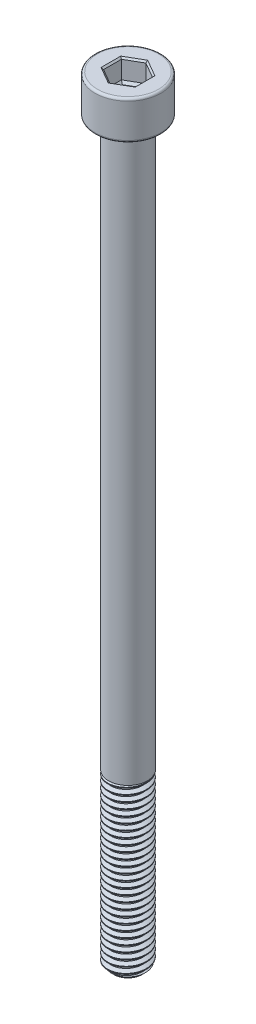
from build123d import *

# Parameters (mm, degrees)
SKETCH1_R           = 2.5
BOSS_EXTRUDE1_DEPTH = 22
THREAD1_PITCH       = 0.8
SKETCH2_R           = 2.5
BOSS_EXTRUDE2_DEPTH = 73
SKETCH3_R           = 4.25
BOSS_EXTRUDE3_DEPTH = 5
FILLET1_R           = 0.3
CUT_EXTRUDE1_DEPTH  = 2.5
CHAMFER1_SIZE       = 0.2
CUT_EXTRUDE2_DEPTH  = 0.3
CUT_EXTRUDE2_DRAFT  = -45


with BuildPart() as part:
    # Sketch1 → Boss-Extrude1 (new body)
    with BuildSketch(Plane(origin=(0, 0, 0), x_dir=(1, 0, 0), z_dir=(0, 1, 0))):
        with Locations(Location((0, 0, 0), (0, 0, 270))):
            Circle(SKETCH1_R)
    extrude(amount=BOSS_EXTRUDE1_DEPTH)

    # Thread1: the profile of Thread Profile1 profile screwed along a right-hand helix of 28.75 turns, 8 arcs to a turn; built about Z, then put on its axis
    thread1_z = Axis((0, 0, 0), (0, 0, 1))
    thread1_corners = [(2.5003, 0, -0.000173205), (2.5003, 0, 0.700173203), (2.0669873, 0, 0.449999999), (2.0669873, 0, 0.249999999)]
    with BuildLine(mode=Mode.PRIVATE) as thread1_profile:
        Line(thread1_corners[0], thread1_corners[1])
        Line(thread1_corners[1], thread1_corners[2])
        Line(thread1_corners[2], thread1_corners[3])
        Line(thread1_corners[3], thread1_corners[0])
    thread1_cap = Face(thread1_profile.wire())
    thread1_turn_angles = [0, 22.5, 45, 67.5, 90, 112.5, 135, 157.5, 180, 202.5, 225, 247.5, 270, 292.5, 315, 337.5, 360]
    thread1_turn_weights = [1, 0.9238795325112867, 1, 0.9238795325112867, 1, 0.9238795325112867, 1, 0.9238795325112867, 1, 0.9238795325112867, 1, 0.9238795325112867, 1, 0.9238795325112867, 1, 0.9238795325112867, 1]
    thread1_turn_rails = [Edge.make_bspline([Vector(p[0], p[1], 0).rotate(thread1_z, thread1_turn_angles[k]) / thread1_turn_weights[k] + Vector(0, 0, p[2] + THREAD1_PITCH * thread1_turn_angles[k] / 360) for k in range(17)], [0, 0, 0, 1, 1, 2, 2, 3, 3, 4, 4, 5, 5, 6, 6, 7, 7, 8, 8, 8], 2, thread1_turn_weights) for p in thread1_corners]
    thread1_turn_sides = [Face.make_surface_from_curves(thread1_turn_rails[p[0]], thread1_turn_rails[p[1]]) for p in [(0, 1), (1, 2), (2, 3), (3, 0)]]
    thread1_last_angles = [10080, 10102.5, 10125, 10147.5, 10170, 10192.5, 10215, 10237.5, 10260, 10282.5, 10305, 10327.5, 10350]
    thread1_last_weights = [1, 0.9238795325112867, 1, 0.9238795325112867, 1, 0.9238795325112867, 1, 0.9238795325112867, 1, 0.9238795325112867, 1, 0.9238795325112867, 1]
    thread1_last_rails = [Edge.make_bspline([Vector(p[0], p[1], 0).rotate(thread1_z, thread1_last_angles[k]) / thread1_last_weights[k] + Vector(0, 0, p[2] + THREAD1_PITCH * thread1_last_angles[k] / 360) for k in range(13)], [0, 0, 0, 1, 1, 2, 2, 3, 3, 4, 4, 5, 5, 6, 6, 6], 2, thread1_last_weights) for p in thread1_corners]
    thread1_last_sides = [Face.make_surface_from_curves(thread1_last_rails[p[0]], thread1_last_rails[p[1]]) for p in [(0, 1), (1, 2), (2, 3), (3, 0)]]
    thread1 = Plane(origin=(0, 23, 0), x_dir=(-1, 0, 0), z_dir=(0, -1, 0)) * Solid(Shell([*[p.moved(Location((0, 0, THREAD1_PITCH * i))) for i in range(28) for p in thread1_turn_sides], *thread1_last_sides, thread1_cap, thread1_cap.rotate(thread1_z, 10350).moved(Location((0, 0, THREAD1_PITCH * 10350 / 360)))]))
    add(thread1, mode=Mode.SUBTRACT)

    # Sketch2 → Boss-Extrude2 (add)
    with BuildSketch(Plane(origin=(0, 22, 0), x_dir=(1, 0, 0), z_dir=(0, 1, 0))):
        with Locations(Location((0, 0, 0), (0, 0, 90))):
            Circle(SKETCH2_R)
    extrude(amount=BOSS_EXTRUDE2_DEPTH)

    # Sketch3 → Boss-Extrude3 (add)
    with BuildSketch(Plane(origin=(0, 95, 0), x_dir=(1, 0, 0), z_dir=(0, 1, 0))):
        with Locations(Location((0, 0, 0), (0, 0, 270))):
            Circle(SKETCH3_R)
    extrude(amount=BOSS_EXTRUDE3_DEPTH)

    # Fillet1
    fillet1_edges = [part.edges().sort_by_distance(p)[0] for p in [
        (0, 95, -4.25),
        (0, 100, -4.25),
    ]]
    fillet(fillet1_edges, radius=FILLET1_R)

    # Sketch4 → Cut-Revolve1 (revolve, cut)
    with BuildSketch(Plane.XY, mode=Mode.PRIVATE) as cut_revolve1_sk:
        Polygon((2.51, 0), (2.51, 0.7), (1.81, 0), align=None)
    revolve(cut_revolve1_sk.sketch.rotate(Axis((0, 0, 0), (0, 1, 0)), 90), axis=Axis((0, 0, 0), (0, 1, 0)), mode=Mode.SUBTRACT)

    # Sketch5 → Cut-Extrude1 (cut)
    with BuildSketch(Plane(origin=(0, 100, 0), x_dir=(1, 0, 0), z_dir=(0, 1, 0))):
        Polygon((0, 2.309401077), (-2, 1.154700538), (-2, -1.154700538), (0, -2.309401077), (2, -1.154700538), (2, 1.154700538), align=None)
    extrude(amount=-CUT_EXTRUDE1_DEPTH, mode=Mode.SUBTRACT)

    # Chamfer1
    chamfer1_edges = [part.edges().sort_by_distance(p)[0] for p in [
        (1, 100, -1.732050808),
        (-1, 100, -1.732050808),
        (-2, 100, 0),
        (-1, 100, 1.732050808),
        (1, 100, 1.732050808),
        (2, 100, 0),
    ]]
    chamfer(chamfer1_edges, length=CHAMFER1_SIZE)


with BuildPart() as cut_extrude2_tool:
    # Sketch6 → Cut-Extrude2 (with draft: the straight prism first)
    with BuildSketch(Plane(origin=(0, 97.5, 0), x_dir=(1, 0, 0), z_dir=(0, 1, 0))):
        Polygon((0, 2.309401077), (-2, 1.154700538), (-2, -1.154700538), (0, -2.309401077), (2, -1.154700538), (2, 1.154700538), align=None)
    extrude(amount=-CUT_EXTRUDE2_DEPTH)
    # Cut-Extrude2: the draft: its side faces are tilted about the plane it starts from
    cut_extrude2_sides = [cut_extrude2_tool.faces().sort_by_distance(p)[0] for p in [
        (-1, 97.35, -1.732050808),
        (-2, 97.35, 0),
        (-1, 97.35, 1.732050808),
        (1, 97.35, 1.732050808),
        (2, 97.35, 0),
        (1, 97.35, -1.732050808),
    ]]
    draft(cut_extrude2_sides, Plane(origin=(0, 97.5, 0), x_dir=(1, 0, 0), z_dir=(0, 1, 0)), CUT_EXTRUDE2_DRAFT)


with BuildPart() as part_1:
    add(part.part)

    # Cut-Extrude2: cut by cut_extrude2_tool
    add(cut_extrude2_tool.part, mode=Mode.SUBTRACT)


solid = part_1.part
